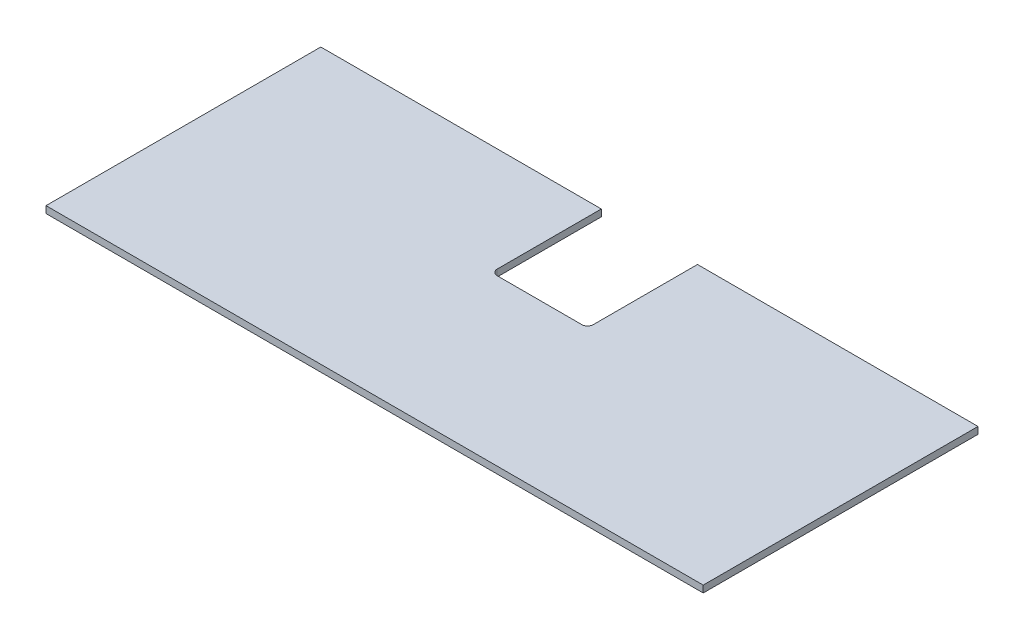
from build123d import *

# Parameters (mm, degrees)
SKETCH1_W           = 287
SKETCH1_H           = 120
BOSS_EXTRUDE1_DEPTH = 3
CUT_EXTRUDE1_DEPTH  = 156.567509461
FILLET1_R           = 2.5


with BuildPart() as part:
    # Sketch1 → Boss-Extrude1 (new body)
    with BuildSketch(Plane(origin=(0, 0, 0), x_dir=(1, 0, 0), z_dir=(0, 1, 0))):
        Rectangle(SKETCH1_W, SKETCH1_H)
    extrude(amount=BOSS_EXTRUDE1_DEPTH)

    # Sketch2 → Cut-Extrude1 (cut, through all)
    with BuildSketch(Plane(origin=(0, 3, 0), x_dir=(1, 0, 0), z_dir=(0, 1, 0))):
        Polygon((-21, 12), (21, 12), (21, 54), (21, 60), (-21, 60), (-21, 54), align=None)
    extrude(amount=-CUT_EXTRUDE1_DEPTH, mode=Mode.SUBTRACT)

    # Fillet1
    fillet1_edges = [part.edges().sort_by_distance(p)[0] for p in [
        (-21, 1.5, -12),
        (21, 1.5, -12),
    ]]
    fillet(fillet1_edges, radius=FILLET1_R)


solid = part.part
